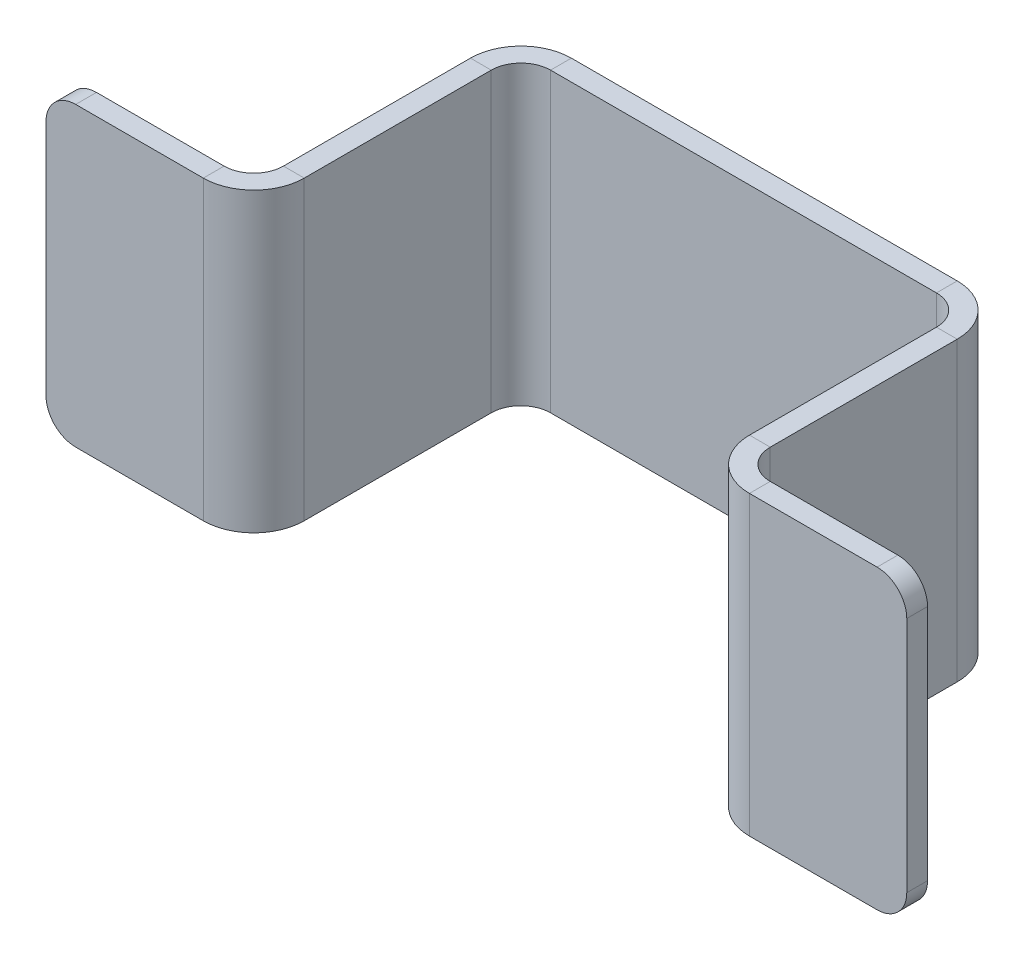
from build123d import *

# Parameters (mm, degrees)
SKETCH2_W                    = 15
SKETCH2_H                    = 10
BASE_FLANGE1_DEPTH           = 0.7
EDGE_FLANGE1_STRIP_W         = 4.8
EDGE_FLANGE1_STRIP_H         = 0.7
EDGE_FLANGE1_STRIP_CUT_DEPTH = 10
EDGE_FLANGE1_DEPTH           = 10
EDGE_FLANGE2_STRIP_W         = 4.8
EDGE_FLANGE2_STRIP_H         = 0.7
EDGE_FLANGE2_STRIP_CUT_DEPTH = 10
EDGE_FLANGE2_DEPTH           = 10
EDGE_FLANGE3_STRIP_W         = 4.8
EDGE_FLANGE3_STRIP_H         = 0.7
EDGE_FLANGE3_STRIP_CUT_DEPTH = 10
EDGE_FLANGE3_DEPTH           = 10
EDGE_FLANGE4_STRIP_W         = 4.8
EDGE_FLANGE4_STRIP_H         = 0.7
EDGE_FLANGE4_STRIP_CUT_DEPTH = 10
EDGE_FLANGE4_DEPTH           = 10
FILLET1_R                    = 1


# Sheet-metal steps are written as plain solids
with BuildPart() as part:
    # Sketch2 → Base-Flange1 (new body)
    with BuildSketch(Plane.XY):
        Rectangle(SKETCH2_W, SKETCH2_H)
    extrude(amount=-BASE_FLANGE1_DEPTH)

    # Edge-Flange1 strip (across the edge) → Edge-Flange1 strip cut (cut)
    with BuildSketch(Plane(origin=(-7.5, 5, 0), x_dir=(1, 0, 0), z_dir=(0, -1, 0))):
        with Locations((-1.4, -0.35)):
            Rectangle(EDGE_FLANGE1_STRIP_W, EDGE_FLANGE1_STRIP_H)
    extrude(amount=EDGE_FLANGE1_STRIP_CUT_DEPTH, mode=Mode.SUBTRACT)

    # Edge-Flange1 section (across the edge) → Edge-Flange1 (add)
    with BuildSketch(Plane(origin=(-7.5, 5, 0), x_dir=(1, 0, 0), z_dir=(0, -1, 0))):
        with BuildLine():
            Line((-0.7, 1), (-0.7, 8.3))
            Line((-0.7, 8.3), (0, 8.3))
            Line((0, 8.3), (0, 1))
            ThreePointArc((0, 1), (0.292893219, 0.292893219), (1, 0))
            Line((1, 0), (1, -0.7))
            ThreePointArc((1, -0.7), (-0.202081528, -0.202081528), (-0.7, 1))
        make_face()
    extrude(amount=EDGE_FLANGE1_DEPTH)

    # Edge-Flange2 strip (across the edge) → Edge-Flange2 strip cut (cut)
    with BuildSketch(Plane(origin=(7.5, -5, 0), x_dir=(-1, 0, 0), z_dir=(0, 1, 0))):
        with Locations((-1.4, -0.35)):
            Rectangle(EDGE_FLANGE2_STRIP_W, EDGE_FLANGE2_STRIP_H)
    extrude(amount=EDGE_FLANGE2_STRIP_CUT_DEPTH, mode=Mode.SUBTRACT)

    # Edge-Flange2 section (across the edge) → Edge-Flange2 (add)
    with BuildSketch(Plane(origin=(7.5, -5, 0), x_dir=(-1, 0, 0), z_dir=(0, 1, 0))):
        with BuildLine():
            Line((-0.7, 1), (-0.7, 8.3))
            Line((-0.7, 8.3), (0, 8.3))
            Line((0, 8.3), (0, 1))
            ThreePointArc((0, 1), (0.292893219, 0.292893219), (1, 0))
            Line((1, 0), (1, -0.7))
            ThreePointArc((1, -0.7), (-0.202081528, -0.202081528), (-0.7, 1))
        make_face()
    extrude(amount=EDGE_FLANGE2_DEPTH)

    # Edge-Flange3 strip (across the edge) → Edge-Flange3 strip cut (cut)
    with BuildSketch(Plane(origin=(8.2, 5, 8.3), x_dir=(0, 0, -1), z_dir=(0, -1, 0))):
        with Locations((-1.4, -0.35)):
            Rectangle(EDGE_FLANGE3_STRIP_W, EDGE_FLANGE3_STRIP_H)
    extrude(amount=EDGE_FLANGE3_STRIP_CUT_DEPTH, mode=Mode.SUBTRACT)

    # Edge-Flange3 section (across the edge) → Edge-Flange3 (add)
    with BuildSketch(Plane(origin=(8.2, 5, 8.3), x_dir=(0, 0, -1), z_dir=(0, -1, 0))):
        with BuildLine():
            Line((-0.7, 1), (-0.7, 6.3))
            Line((-0.7, 6.3), (0, 6.3))
            Line((0, 6.3), (0, 1))
            ThreePointArc((0, 1), (0.292893219, 0.292893219), (1, 0))
            Line((1, 0), (1, -0.7))
            ThreePointArc((1, -0.7), (-0.202081528, -0.202081528), (-0.7, 1))
        make_face()
    extrude(amount=EDGE_FLANGE3_DEPTH)

    # Edge-Flange4 strip (across the edge) → Edge-Flange4 strip cut (cut)
    with BuildSketch(Plane(origin=(-8.2, -5, 8.3), x_dir=(0, 0, -1), z_dir=(0, 1, 0))):
        with Locations((-1.4, -0.35)):
            Rectangle(EDGE_FLANGE4_STRIP_W, EDGE_FLANGE4_STRIP_H)
    extrude(amount=EDGE_FLANGE4_STRIP_CUT_DEPTH, mode=Mode.SUBTRACT)

    # Edge-Flange4 section (across the edge) → Edge-Flange4 (add)
    with BuildSketch(Plane(origin=(-8.2, -5, 8.3), x_dir=(0, 0, -1), z_dir=(0, 1, 0))):
        with BuildLine():
            Line((-0.7, 1), (-0.7, 6.3))
            Line((-0.7, 6.3), (0, 6.3))
            Line((0, 6.3), (0, 1))
            ThreePointArc((0, 1), (0.292893219, 0.292893219), (1, 0))
            Line((1, 0), (1, -0.7))
            ThreePointArc((1, -0.7), (-0.202081528, -0.202081528), (-0.7, 1))
        make_face()
    extrude(amount=EDGE_FLANGE4_DEPTH)

    # Fillet1
    fillet1_edges = [part.edges().sort_by_distance(p)[0] for p in [
        (14.5, -5, 8.65),
        (-14.5, -5, 8.65),
        (-14.5, 5, 8.65),
        (14.5, 5, 8.65),
    ]]
    fillet(fillet1_edges, radius=FILLET1_R)


solid = part.part
